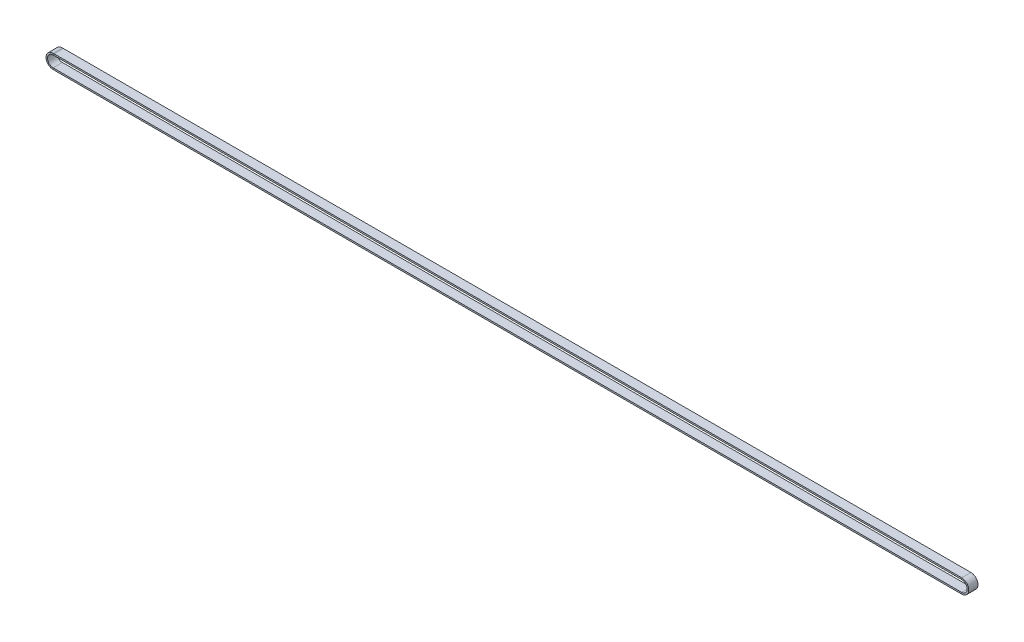
from build123d import *

# Parameters (mm, degrees)
SKETCH3_W = 9
SKETCH3_H = 1.5


with BuildPart() as part:
    # Sweep1: sweep along a path in Sketch2
    with BuildLine(Plane.XY.offset(-133.733366658)) as sweep1_path:
        Line((-1, 148.379342701), (883.52063783, 148.379342701))
        ThreePointArc((883.52063783, 148.379342701), (890.42063783, 141.479342701), (883.52063783, 134.579342701))
        Line((883.52063783, 134.579342701), (-1, 134.579342701))
        ThreePointArc((-1, 134.579342701), (-7.9, 141.479342701), (-1, 148.379342701))
    # Sketch3 → Sweep1 (sweep)
    with BuildSketch(Plane(origin=(0, 0, 0), x_dir=(0, 0, -1), z_dir=(1, 0, 0))):
        with Locations((129.233366658, 147.629342701)):
            Rectangle(SKETCH3_W, SKETCH3_H)
    sweep(path=sweep1_path.line)


solid = part.part
